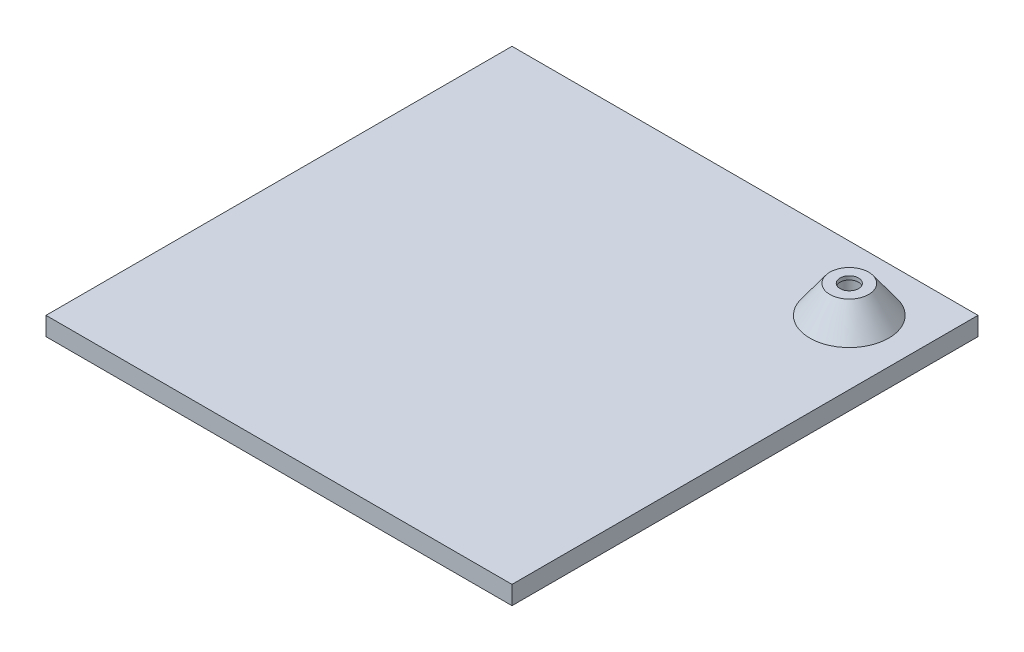
from build123d import *

# Parameters (mm, degrees)
SKETCH1_W           = 126
SKETCH1_H           = 126
BOSS_EXTRUDE1_DEPTH = 5
SKETCH3_R           = 12.5
BOSS_EXTRUDE2_DEPTH = 7.5
SKETCH4_R           = 2.95
CUT_EXTRUDE1_DEPTH  = 11.5
SKETCH6_R           = 2.5
CUT_EXTRUDE2_DEPTH  = 179.628805068
CHAMFER1_SIZE       = 10
CHAMFER1_SIZE_2     = 7.26542528


with BuildPart() as part:
    # Sketch1 → Boss-Extrude1 (new body)
    with BuildSketch(Plane(origin=(0, 0, 0), x_dir=(1, 0, 0), z_dir=(0, 1, 0))):
        with Locations((63, 63)):
            Rectangle(SKETCH1_W, SKETCH1_H)
    extrude(amount=BOSS_EXTRUDE1_DEPTH)

    # Sketch3 → Boss-Extrude2 (add)
    with BuildSketch(Plane(origin=(0, 5, 0), x_dir=(1, 0, 0), z_dir=(0, 1, 0))):
        with Locations(Location((108.6, 108.6, 0), (0, 0, 90))):
            Circle(SKETCH3_R)
    extrude(amount=BOSS_EXTRUDE2_DEPTH)

    # Sketch4 → Cut-Extrude1 (cut)
    with BuildSketch(Plane.XZ):
        with Locations(Location((108.6, -108.6, 0), (0, 0, 270))):
            Circle(SKETCH4_R)
    extrude(amount=-CUT_EXTRUDE1_DEPTH, mode=Mode.SUBTRACT)

    # Sketch6 → Cut-Extrude2 (cut, through all)
    with BuildSketch(Plane(origin=(0, 12.5, 0), x_dir=(1, 0, 0), z_dir=(0, 1, 0))):
        with Locations(Location((108.6, 108.6, 0), (0, 0, 270))):
            Circle(SKETCH6_R)
    extrude(amount=-CUT_EXTRUDE2_DEPTH, mode=Mode.SUBTRACT)

    # Chamfer1
    # the kernel refuses this chamfer: 10, 7.26542528 mm, written as the material it takes off along each edge
    with BuildSketch(Plane(origin=(108.6, 12.5, -108.6), x_dir=(0, 0, -1), z_dir=(1, 0, 0))) as chamfer1_piece_1_section:
        Polygon((12.5, -CHAMFER1_SIZE), (12.5 - CHAMFER1_SIZE_2, 0), (12.5, 0), align=None)
    chamfer1_piece_1 = revolve(axis=Axis((108.6, 12.5, -108.6), (0, 1, 0)), mode=Mode.PRIVATE)
    chamfer1_piece_1 = split(chamfer1_piece_1, bisect_by=Plane(origin=(108.6, 5, -100.650989912), z_dir=(0, 1, 0)), keep=Keep.TOP, mode=Mode.PRIVATE)
    add(chamfer1_piece_1, mode=Mode.SUBTRACT)


solid = part.part
